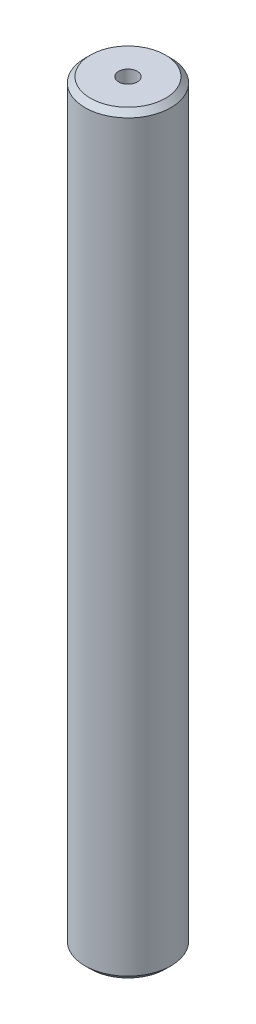
from build123d import *

# Parameters (mm, degrees)
SKETCH1_R           = 5
BOSS_EXTRUDE1_DEPTH = 87.810362406
SKETCH2_R           = 1.084794339
CUT_EXTRUDE1_DEPTH  = 89.094606793
CHAMFER1_SIZE       = 0.631787953


with BuildPart() as part:
    # Sketch1 → Boss-Extrude1 (new body)
    with BuildSketch(Plane(origin=(0, 0, 0), x_dir=(1, 0, 0), z_dir=(0, 1, 0))):
        Circle(SKETCH1_R)
    extrude(amount=BOSS_EXTRUDE1_DEPTH)

    # Sketch2 → Cut-Extrude1 (cut, through all)
    with BuildSketch(Plane(origin=(0, 0, 0), x_dir=(1, 0, 0), z_dir=(0, 1, 0))):
        Circle(SKETCH2_R)
    extrude(amount=CUT_EXTRUDE1_DEPTH, mode=Mode.SUBTRACT)

    # Chamfer1
    chamfer1_edges = [part.edges().sort_by_distance(p)[0] for p in [
        (-5, 87.810362406, 0),
        (-5, 0, 0),
    ]]
    chamfer(chamfer1_edges, length=CHAMFER1_SIZE)


solid = part.part
